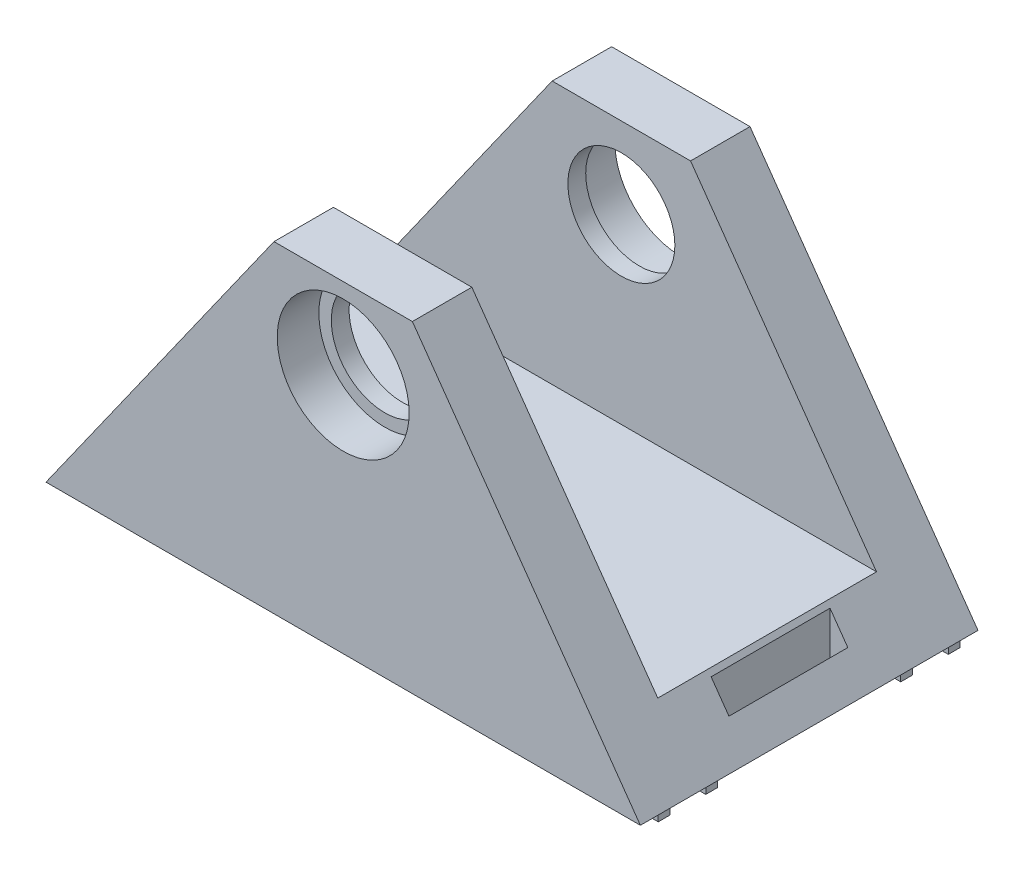
from build123d import *

# Parameters (mm, degrees)
SKETCH_1_W             = 100
SKETCH_1_H             = 28.4
EXTRUDE_1_DEPTH        = 10
SKETCH_2_W             = 100
SKETCH_2_H             = 10
EXTRUDE_2_DEPTH        = 45.6
FILLET_2_R             = 50
SKETCH_3_R             = 11.1
CUT_EXTRUDE_1_DEPTH    = 7
FILLET_2_OF_MIRROR_2_R = 50
SKETCH_8_R             = 9
CUT_EXTRUDE_2_DEPTH    = 90.840970609
SKETCH2_W              = 3
SKETCH2_H              = 20
CUT_EXTRUDE1_DEPTH     = 87.058817096
SKETCH3_OUTSIDE_W      = 127.548
SKETCH3_OUTSIDE_H      = 83.148
CUT_EXTRUDE3_DEPTH     = 94.902076654
SKETCH1_W              = 100
SKETCH1_H              = 2
SKETCH1_W_2            = 1.153846154
SKETCH1_H_2            = 18
SKETCH1_W_3            = 1.153846153
BOSS_EXTRUDE1_DEPTH    = 1
CUT_EXTRUDE4_DEPTH     = 94.902076708


with BuildPart() as part:
    # Эскиз1 → Бобышка-Вытянуть1 (new body)
    with BuildSketch(Plane(origin=(0, 0, 0), x_dir=(1, 0, 0), z_dir=(0, 1, 0))):
        Rectangle(SKETCH_1_W, SKETCH_1_H)
    extrude_1 = extrude(amount=EXTRUDE_1_DEPTH)

    # Эскиз2 → Бобышка-Вытянуть2 (add)
    with BuildSketch(Plane(origin=(0, 10, 0), x_dir=(1, 0, 0), z_dir=(0, 1, 0))):
        with Locations((0, -9.2)):
            Rectangle(SKETCH_2_W, SKETCH_2_H)
    extrude_2 = extrude(amount=EXTRUDE_2_DEPTH)

    # Скругление2
    fillet_2_edges = [part.edges().sort_by_distance(p)[0] for p in [
        (50, 55.6, 9.2),
        (-50, 55.6, 9.2),
    ]]
    fillet(fillet_2_edges, radius=FILLET_2_R - 0.0001)  # a hair under: the kernel refuses the full size

    # Эскиз3 → Вырез-Вытянуть1 (cut)
    with BuildSketch(Plane.XY.offset(14.2)):
        with Locations((0, 40.6)):
            Circle(SKETCH_3_R)
    cut_extrude_1 = extrude(amount=-CUT_EXTRUDE_1_DEPTH, mode=Mode.SUBTRACT)


with BuildPart() as mirror_2_1:
    # Зеркальное отражение2: Бобышка-Вытянуть1, Бобышка-Вытянуть2 across plane
    add(extrude_1.mirror(Plane(origin=(-50, 10, -14.2), x_dir=(1, 0, 0), z_dir=(0, 0, 1))))
    add(extrude_2.mirror(Plane(origin=(-50, 10, -14.2), x_dir=(1, 0, 0), z_dir=(0, 0, 1))))

    # Mirror 2 2: Вырез-Вытянуть1 across plane
    add(cut_extrude_1.mirror(Plane(origin=(-50, 10, -14.2), x_dir=(1, 0, 0), z_dir=(0, 0, 1))), mode=Mode.SUBTRACT)

    # Скругление2 of Зеркальное отражение2
    fillet_2_of_mirror_2_edges = [mirror_2_1.edges().sort_by_distance(p)[0] for p in [
        (50, 55.6, -37.6),
        (-50, 55.6, -37.6),
    ]]
    fillet(fillet_2_of_mirror_2_edges, radius=FILLET_2_OF_MIRROR_2_R - 0.0001)  # a hair under: the kernel refuses the full size


with BuildPart() as part_1:
    add(part.part)

    # Зеркальное отражение2 united with what the copies tou: union Зеркальное отражение2_1
    add(mirror_2_1.part)

    # Эскиз8 → Вырез-Вытянуть2 (cut, through all)
    with BuildSketch(Plane.XY.offset(7.2)):
        with Locations((0, 40.6)):
            Circle(SKETCH_8_R)
    extrude(amount=-CUT_EXTRUDE_2_DEPTH, mode=Mode.SUBTRACT)

    # Sketch2 → Cut-Extrude1 (cut, through all)
    with BuildSketch(Plane.XZ):
        with Locations((-45, -14.2)):
            Rectangle(SKETCH2_W, SKETCH2_H)
        with Locations((45, -14.2)):
            Rectangle(SKETCH2_W, SKETCH2_H)
    extrude(amount=-CUT_EXTRUDE1_DEPTH, mode=Mode.SUBTRACT)

    # Sketch3 outside → Cut-Extrude3 (cut, through all)
    with BuildSketch(Plane(origin=(0, 0, -42.6), x_dir=(-1, 0, 0), z_dir=(0, 0, -1))):
        with Locations((0, 27.8)):
            Rectangle(SKETCH3_OUTSIDE_W, SKETCH3_OUTSIDE_H)
        with BuildLine():
            Line((-50, 0), (-11.641765151, 54.225809034))
            ThreePointArc((-11.641765151, 54.225809034), (0, 55.6), (11.641765151, 54.225809034))
            Line((11.641765151, 54.225809034), (50, 0))
            Line((50, 0), (-50, 0))
        make_face(mode=Mode.SUBTRACT)
    extrude(amount=-CUT_EXTRUDE3_DEPTH, mode=Mode.SUBTRACT)

    # Sketch1 → Boss-Extrude1 (add)
    # profile 1 of 17: a face of its own
    with BuildSketch(Plane.XZ):
        with Locations((0, 10.2)):
            Rectangle(SKETCH1_W, SKETCH1_H)
    # profile 2 of 17: a face of its own
    with BuildSketch(Plane.XZ):
        with Locations((0, 2.2)):
            Rectangle(SKETCH1_W, SKETCH1_H)
    # profile 3 of 17: a face of its own
    with BuildSketch(Plane.XZ):
        with Locations((0, -30.6)):
            Rectangle(SKETCH1_W, SKETCH1_H)
    # profile 4 of 17: a face of its own
    with BuildSketch(Plane.XZ):
        with Locations((0, -38.6)):
            Rectangle(SKETCH1_W, SKETCH1_H)
    # profile 5 of 17: a face of its own
    with BuildSketch(Plane.XZ):
        with BuildLine():
            Line((-40.638461538, -16.369230769), (-39.484615385, -16.369230769))
            add(Edge.make_bspline(
                [(-39.484615385, -16.369230769), (-39.470240069, -16.596617655), (-39.44279661, -17.03071477), (-39.365105323, -17.648903711), (-39.272429521, -18.205370063), (-39.146233002, -18.700136872), (-38.990553559, -19.14241624), (-38.797560103, -19.538074087), (-38.558801391, -19.88711608), (-38.293474168, -20.194192475), (-37.993730655, -20.441175936), (-37.673503913, -20.621857637), (-37.331935649, -20.733158575), (-37.097203659, -20.746902209), (-36.978605769, -20.753846154)],
                knots=[0, 0, 0, 0, 1.476778541, 2.81927122, 4.037588394, 5.131871797, 6.125167747, 7.073045178, 7.976447362, 8.859765014, 9.69586766, 10.48072617, 11.232389795, 12, 12, 12, 12], degree=3))
            add(Edge.make_bspline(
                [(-36.978605769, -20.753846154), (-36.873337395, -20.750034724), (-36.666514199, -20.742546321), (-36.370365183, -20.651957179), (-36.089166188, -20.523109791), (-35.834497024, -20.33171486), (-35.603177794, -20.097333476), (-35.404587047, -19.818448735), (-35.232796258, -19.503626344), (-35.105040234, -19.150543102), (-35.001248797, -18.778965217), (-34.926077834, -18.395572012), (-34.876581466, -18.006345819), (-34.871683203, -17.744380463), (-34.869230769, -17.613221154)],
                knots=[0, 0, 0, 0, 0.898159175, 1.76463399, 2.630008209, 3.535623063, 4.474309597, 5.439690797, 6.45724568, 7.535187984, 8.646219107, 9.758202923, 10.877589923, 12, 12, 12, 12], degree=3))
            add(Edge.make_bspline(
                [(-34.869230769, -17.613221154), (-34.871727675, -17.483266794), (-34.876574462, -17.231010117), (-34.92155378, -16.867023087), (-34.987979097, -16.52680655), (-35.088962238, -16.211910774), (-35.223777726, -15.917601377), (-35.397418068, -15.646269438), (-35.612722275, -15.395980759), (-35.784019122, -15.255027793), (-35.871634615, -15.182932692)],
                knots=[0, 0, 0, 0, 1.141262938, 2.215325403, 3.217692236, 4.182821609, 5.113601202, 6.0539165, 7.004610607, 8, 8, 8, 8], degree=3))
            add(Edge.make_bspline(
                [(-35.871634615, -15.182932692), (-35.904856333, -15.157068563), (-35.978627549, -15.099635403), (-36.111161552, -15.019936359), (-36.263722176, -14.921033064), (-36.445510914, -14.816582227), (-36.655670934, -14.705405164), (-36.892891163, -14.583637393), (-37.15605257, -14.450074402), (-37.528608514, -14.264929513), (-37.975259739, -14.038174056), (-38.44571128, -13.752014016), (-38.833801628, -13.480550628), (-39.043081268, -13.2802365), (-39.138461538, -13.188942308)],
                knots=[0, 0, 0, 0, 0.394245612, 0.875450753, 1.447377332, 2.09846139, 2.839245878, 3.675529186, 4.597402822, 5.604899952, 7.574872462, 9.288395252, 10.764172218, 12, 12, 12, 12], degree=3))
            add(Edge.make_bspline(
                [(-39.138461538, -13.188942308), (-39.241135667, -13.072238788), (-39.447630986, -12.837527952), (-39.7080101, -12.438185142), (-39.928790257, -12.000675375), (-40.103604675, -11.521853609), (-40.240616064, -11.00884278), (-40.334600048, -10.464434586), (-40.400206131, -9.891255139), (-40.405155603, -9.49923539), (-40.407692308, -9.298317308)],
                knots=[0, 0, 0, 0, 0.889041188, 1.788014626, 2.720525071, 3.689472716, 4.701054498, 5.756667369, 6.850246473, 8, 8, 8, 8], degree=3))
            add(Edge.make_bspline(
                [(-40.407692308, -9.298317308), (-40.402701433, -9.07576653), (-40.392854974, -8.636697839), (-40.319158363, -7.99046285), (-40.200178795, -7.367171614), (-40.037149209, -6.772619837), (-39.829756508, -6.221805409), (-39.574641924, -5.731786189), (-39.269876191, -5.316366752), (-38.925024855, -4.973681021), (-38.547822053, -4.703215562), (-38.145223594, -4.510255541), (-37.719519885, -4.392632081), (-37.428859642, -4.377103832), (-37.281490385, -4.369230769)],
                knots=[0, 0, 0, 0, 1.236485598, 2.439452788, 3.60918054, 4.759663196, 5.861119231, 6.873962529, 7.819732486, 8.712337971, 9.564836949, 10.386372061, 11.181865577, 12, 12, 12, 12], degree=3))
            add(Edge.make_bspline(
                [(-37.281490385, -4.369230769), (-37.120854172, -4.376462962), (-36.805766375, -4.390648902), (-36.348019557, -4.515245023), (-35.922797189, -4.719682583), (-35.529139192, -5.002875846), (-35.168257302, -5.359349935), (-34.855459962, -5.79731981), (-34.587996233, -6.309006145), (-34.36922057, -6.889032343), (-34.191354819, -7.523978514), (-34.057398603, -8.2050002), (-33.975910157, -8.927487832), (-33.956231096, -9.423119899), (-33.946153846, -9.676923077)],
                knots=[0, 0, 0, 0, 0.829483579, 1.627031341, 2.433250974, 3.257665783, 4.123495838, 5.044753213, 6.029002171, 7.101332963, 8.244528218, 9.435456943, 10.686749258, 12, 12, 12, 12], degree=3))
            Line((-33.946153846, -9.676923077), (-35.1, -9.676923077))
            add(Edge.make_bspline(
                [(-35.1, -9.676923077), (-35.108313553, -9.548194977), (-35.124507677, -9.29744313), (-35.169645089, -8.93451771), (-35.220292019, -8.594112104), (-35.294167263, -8.280639774), (-35.376614716, -7.991671244), (-35.468873937, -7.724857805), (-35.581513568, -7.484889615), (-35.703025002, -7.266005554), (-35.84085689, -7.073686026), (-35.992856496, -6.904553964), (-36.163378237, -6.765238869), (-36.346695388, -6.64504225), (-36.548624984, -6.557807018), (-36.764473233, -6.489850217), (-36.996793923, -6.456074551), (-37.156407826, -6.449515712), (-37.238221154, -6.446153846)],
                knots=[0, 0, 0, 0, 1.42965333, 2.784848158, 4.053155636, 5.242584303, 6.351687018, 7.384193992, 8.367830726, 9.286707789, 10.155636564, 10.98558737, 11.799337186, 12.590297035, 13.407421389, 14.22931162, 15.092397929, 16, 16, 16, 16], degree=3))
            add(Edge.make_bspline(
                [(-37.238221154, -6.446153846), (-37.323782274, -6.44727498), (-37.488716914, -6.449436171), (-37.726234132, -6.493098806), (-37.946642057, -6.551063507), (-38.148824706, -6.640065235), (-38.332546739, -6.75221238), (-38.502531383, -6.886636015), (-38.649061822, -7.050761306), (-38.823592916, -7.299122737), (-38.993936421, -7.650434557), (-39.149212103, -8.107677475), (-39.238924014, -8.60732932), (-39.248781326, -8.954216372), (-39.253846154, -9.132451923)],
                knots=[0, 0, 0, 0, 0.811019, 1.563386801, 2.286085922, 2.970938193, 3.652071782, 4.325803093, 5.020568278, 5.733011965, 7.202937869, 8.707889852, 10.308466513, 12, 12, 12, 12], degree=3))
            add(Edge.make_bspline(
                [(-39.253846154, -9.132451923), (-39.25033482, -9.286638358), (-39.243606789, -9.58207341), (-39.17505776, -10.003170282), (-39.078847482, -10.38703283), (-38.965748468, -10.613544413), (-38.911298077, -10.722596154)],
                knots=[0, 0, 0, 0, 1.125042715, 2.155682834, 3.112071911, 4, 4, 4, 4], degree=3))
            add(Edge.make_bspline(
                [(-38.911298077, -10.722596154), (-38.87887715, -10.775141525), (-38.810132888, -10.886556995), (-38.674240722, -11.045379752), (-38.503319965, -11.202800868), (-38.300363896, -11.361408357), (-38.063409325, -11.520218993), (-37.793819538, -11.681417103), (-37.49056137, -11.843808094), (-37.161415843, -11.9993082), (-36.830986368, -12.156850667), (-36.517961441, -12.310965878), (-36.231499202, -12.459371164), (-35.972653066, -12.601140025), (-35.743810001, -12.743496256), (-35.542828782, -12.879282828), (-35.368221091, -13.009167934), (-35.264269213, -13.097107105), (-35.215384615, -13.138461538)],
                knots=[0, 0, 0, 0, 0.663902341, 1.407716605, 2.240709003, 3.162151828, 4.177708994, 5.309352116, 6.542302523, 7.879028444, 9.227412714, 10.483032392, 11.634617897, 12.70028532, 13.658946062, 14.534557668, 15.310858445, 16, 16, 16, 16], degree=3))
            add(Edge.make_bspline(
                [(-35.215384615, -13.138461538), (-35.091271425, -13.262487039), (-34.842607481, -13.510975294), (-34.536810296, -13.949937764), (-34.274330041, -14.42995553), (-34.07261966, -14.961964512), (-33.90892847, -15.533392773), (-33.795709078, -16.149198556), (-33.726140303, -16.806314395), (-33.719033491, -17.258472104), (-33.715384615, -17.490625)],
                knots=[0, 0, 0, 0, 0.887701028, 1.778531668, 2.699812275, 3.654560257, 4.655306023, 5.709062331, 6.823755953, 8, 8, 8, 8], degree=3))
            add(Edge.make_bspline(
                [(-33.715384615, -17.490625), (-33.720463952, -17.72516724), (-33.730464754, -18.186961833), (-33.803020723, -18.870998108), (-33.930054879, -19.532315192), (-34.100317821, -20.167507968), (-34.315034718, -20.757640722), (-34.577938696, -21.287511035), (-34.889890711, -21.745121009), (-35.23842285, -22.133350408), (-35.620567866, -22.445904957), (-36.036644302, -22.66481407), (-36.475383961, -22.807513004), (-36.779215327, -22.822996779), (-36.931730769, -22.830769231)],
                knots=[0, 0, 0, 0, 1.228451076, 2.418720254, 3.597898869, 4.752485211, 5.859990663, 6.882028285, 7.842446672, 8.751689625, 9.60709352, 10.412573381, 11.203153136, 12, 12, 12, 12], degree=3))
            add(Edge.make_bspline(
                [(-36.931730769, -22.830769231), (-37.028012027, -22.829083514), (-37.217676594, -22.82576282), (-37.495033994, -22.787923719), (-37.762050135, -22.730569605), (-38.0174662, -22.648414872), (-38.259833653, -22.539534588), (-38.488979137, -22.406982615), (-38.710076719, -22.257325659), (-38.916595329, -22.078037493), (-39.110419138, -21.875212162), (-39.296370445, -21.65168912), (-39.46481157, -21.399381019), (-39.626825875, -21.126512361), (-39.778908684, -20.829208902), (-39.918336814, -20.508401251), (-40.048790482, -20.16440629), (-40.207985741, -19.669173139), (-40.374606617, -19.008062348), (-40.514777163, -18.172238921), (-40.612241573, -17.287282165), (-40.629563053, -16.680797426), (-40.638461538, -16.369230769)],
                knots=[0, 0, 0, 0, 0.697916832, 1.374827219, 2.026335778, 2.676968848, 3.316943287, 3.949512024, 4.595161574, 5.250450397, 5.928650726, 6.628524948, 7.356346523, 8.126334024, 8.929510947, 9.776622364, 10.662287248, 11.596886092, 13.548473786, 15.600852347, 17.740045811, 20, 20, 20, 20], degree=3))
        make_face()
    # profile 6 of 17: a face of its own
    with BuildSketch(Plane.XZ):
        with Locations((-32.123076923, -13.6)):
            Rectangle(SKETCH1_W_2, SKETCH1_H_2)
    # profile 7 of 17: a face of its own
    with BuildSketch(Plane.XZ):
        with BuildLine():
            Line((-30.3, -22.6), (-30.3, -4.6))
            Line((-30.3, -4.6), (-28.396153846, -4.6))
            Line((-28.396153846, -4.6), (-26.427403846, -17.231009615))
            add(Edge.make_bspline(
                [(-26.427403846, -17.231009615), (-26.405794892, -17.374042341), (-26.364024011, -17.650529717), (-26.303121605, -18.050831215), (-26.244133517, -18.421845884), (-26.194483406, -18.765903372), (-26.147556468, -19.082001053), (-26.104826688, -19.370543063), (-26.063510407, -19.630941859), (-26.04129709, -19.79587124), (-26.030769231, -19.874038462)],
                knots=[0, 0, 0, 0, 1.298987977, 2.510990224, 3.63601153, 4.6724294, 5.632529389, 6.505636504, 7.291756016, 8, 8, 8, 8], degree=3))
            add(Edge.make_bspline(
                [(-26.030769231, -19.874038462), (-26.018944381, -19.788673647), (-25.993778376, -19.606997645), (-25.949941213, -19.321197736), (-25.903124269, -19.006285963), (-25.852334869, -18.663783022), (-25.799497527, -18.292023468), (-25.736588959, -17.892205537), (-25.673154549, -17.462709551), (-25.626024894, -17.167260982), (-25.601682692, -17.014663462)],
                knots=[0, 0, 0, 0, 0.715320173, 1.522366223, 2.399954946, 3.357955327, 4.396370647, 5.516670333, 6.717374232, 8, 8, 8, 8], degree=3))
            Line((-25.601682692, -17.014663462), (-23.665384615, -4.6))
            Line((-23.665384615, -4.6), (-21.761538462, -4.6))
            Line((-21.761538462, -4.6), (-21.761538462, -22.6))
            Line((-21.761538462, -22.6), (-22.915384615, -22.6))
            Line((-22.915384615, -22.6), (-22.915384615, -7.369230769))
            Line((-22.915384615, -7.369230769), (-25.251923077, -22.6))
            Line((-25.251923077, -22.6), (-26.809615385, -22.6))
            Line((-26.809615385, -22.6), (-29.146153846, -7.369230769))
            Line((-29.146153846, -7.369230769), (-29.146153846, -22.6))
            Line((-29.146153846, -22.6), (-30.3, -22.6))
        make_face()
    # profile 8 of 17: a face of its own
    with BuildSketch(Plane.XZ):
        with BuildLine():
            Line((-14.515384615, -16.246634615), (-13.361538462, -16.837980769))
            add(Edge.make_bspline(
                [(-13.361538462, -16.837980769), (-13.392293499, -17.075000097), (-13.451935185, -17.534639667), (-13.566911058, -18.201452035), (-13.705121838, -18.82375911), (-13.853576767, -19.404855568), (-14.024799586, -19.941142768), (-14.208372783, -20.43594912), (-14.420653792, -20.884256023), (-14.641448838, -21.292071207), (-14.878353952, -21.654338639), (-15.131888959, -21.967598698), (-15.399402727, -22.232209508), (-15.677258365, -22.451686906), (-15.970810015, -22.621782581), (-16.278840553, -22.740092039), (-16.599515067, -22.815811524), (-16.817856964, -22.825764599), (-16.927644231, -22.830769231)],
                knots=[0, 0, 0, 0, 1.5193499, 2.946398261, 4.299805446, 5.571177664, 6.757700431, 7.877387893, 8.923396472, 9.908256442, 10.823775054, 11.671065638, 12.465325907, 13.21121476, 13.916343278, 14.613058763, 15.302614435, 16, 16, 16, 16], degree=3))
            add(Edge.make_bspline(
                [(-16.927644231, -22.830769231), (-17.040820301, -22.827321191), (-17.263696051, -22.820531022), (-17.590079733, -22.766392859), (-17.899603014, -22.6710358), (-18.192072886, -22.54061082), (-18.470446108, -22.376672837), (-18.731532723, -22.17362549), (-18.971667411, -21.928960322), (-19.200893037, -21.653544859), (-19.412144273, -21.341990968), (-19.611892776, -20.997801945), (-19.79282099, -20.618645838), (-19.967331224, -20.208882805), (-20.129196383, -19.767741032), (-20.27244128, -19.291351426), (-20.405124905, -18.783626555), (-20.569932366, -18.057545156), (-20.73236129, -17.106781567), (-20.871364768, -15.929649614), (-20.961278811, -14.711969761), (-20.971651756, -13.886217277), (-20.976923077, -13.466586538)],
                knots=[0, 0, 0, 0, 0.60887351, 1.199044466, 1.77399005, 2.347332488, 2.91862805, 3.508621751, 4.12150184, 4.760024969, 5.434615555, 6.144649701, 6.899689604, 7.693808557, 8.540974356, 9.426933518, 10.369832526, 11.364679693, 13.432997972, 15.556677835, 17.741993394, 20, 20, 20, 20], degree=3))
            add(Edge.make_bspline(
                [(-20.976923077, -13.466586538), (-20.975892912, -13.238194781), (-20.973859029, -12.787274769), (-20.947158034, -12.12244645), (-20.907954155, -11.480436029), (-20.854942529, -10.860951265), (-20.782096863, -10.264747979), (-20.697055512, -9.689484251), (-20.591499451, -9.13782809), (-20.47328269, -8.60850879), (-20.3416522, -8.10512567), (-20.192790435, -7.633013116), (-20.035948189, -7.189710073), (-19.858659281, -6.780287165), (-19.671553844, -6.400840278), (-19.473502645, -6.050752921), (-19.257065756, -5.735005278), (-19.030494475, -5.448183125), (-18.791919013, -5.197169613), (-18.55132227, -4.974109317), (-18.300293205, -4.789106821), (-18.043238181, -4.636385538), (-17.780129146, -4.515973806), (-17.509712434, -4.432862166), (-17.234957791, -4.380406225), (-17.049266142, -4.372954047), (-16.956490385, -4.369230769)],
                knots=[0, 0, 0, 0, 1.521152845, 3.003253126, 4.430972634, 5.805191119, 7.143735297, 8.431048613, 9.677717339, 10.883833092, 12.04310164, 13.142002956, 14.180267897, 15.173642948, 16.111668452, 16.997403118, 17.850067855, 18.658992496, 19.429198441, 20.154580437, 20.841479779, 21.501883115, 22.143233042, 22.763604345, 23.382268698, 24, 24, 24, 24], degree=3))
            add(Edge.make_bspline(
                [(-16.956490385, -4.369230769), (-16.851583823, -4.373250456), (-16.644510173, -4.381184861), (-16.340588825, -4.448884238), (-16.050739223, -4.559299986), (-15.769405821, -4.705514745), (-15.509965244, -4.90637277), (-15.257556691, -5.142209874), (-15.021985788, -5.424837361), (-14.797831281, -5.747115272), (-14.591363361, -6.108131913), (-14.394058733, -6.502838919), (-14.220648502, -6.93439654), (-14.060845762, -7.400214642), (-13.917368316, -7.899602095), (-13.792630885, -8.435567366), (-13.679111173, -9.005216309), (-13.621761237, -9.39897629), (-13.592307692, -9.601201923)],
                knots=[0, 0, 0, 0, 0.74607332, 1.472664073, 2.203623599, 2.949942136, 3.719913209, 4.530902478, 5.405044804, 6.333001834, 7.322010583, 8.362694247, 9.471612332, 10.629575204, 11.867012269, 13.168111225, 14.545610195, 16, 16, 16, 16], degree=3))
            Line((-13.592307692, -9.601201923), (-14.746153846, -10.145673077))
            add(Edge.make_bspline(
                [(-14.746153846, -10.145673077), (-14.771768261, -9.990480706), (-14.821528034, -9.688996665), (-14.907178946, -9.254678889), (-15.001256815, -8.85307655), (-15.100513193, -8.484057934), (-15.212702363, -8.14869804), (-15.331187163, -7.845108514), (-15.456205344, -7.572665469), (-15.59305384, -7.333933348), (-15.739404973, -7.126429977), (-15.889526229, -6.943507196), (-16.054036671, -6.790769291), (-16.226491947, -6.663716427), (-16.408397799, -6.565016829), (-16.598900441, -6.494966695), (-16.799779746, -6.455025502), (-16.937086529, -6.449146211), (-17.006971154, -6.446153846)],
                knots=[0, 0, 0, 0, 1.606280933, 3.120437325, 4.519791905, 5.818113984, 7.021397336, 8.129172842, 9.145074104, 10.079877348, 10.934613958, 11.736134785, 12.491694017, 13.220869476, 13.918363091, 14.597913148, 15.286384024, 16, 16, 16, 16], degree=3))
            add(Edge.make_bspline(
                [(-17.006971154, -6.446153846), (-17.086557407, -6.448551774), (-17.244749988, -6.453318105), (-17.476011347, -6.503006503), (-17.699017726, -6.577693668), (-17.908781014, -6.688426917), (-18.109961635, -6.826073851), (-18.296745182, -6.998988878), (-18.479008009, -7.197415598), (-18.706438869, -7.512886728), (-18.964435855, -7.967552035), (-19.213321756, -8.589769855), (-19.417588027, -9.292898765), (-19.570276313, -10.067071051), (-19.680243108, -10.887798173), (-19.765161082, -11.731937718), (-19.810755309, -12.589880155), (-19.818954343, -13.166059035), (-19.823076923, -13.455769231)],
                knots=[0, 0, 0, 0, 0.464748692, 0.923775043, 1.377224762, 1.836197296, 2.306073311, 2.798738052, 3.321187459, 3.879298539, 5.069318024, 6.368040087, 7.789256127, 9.345533132, 10.977717257, 12.630370562, 14.305706716, 16, 16, 16, 16], degree=3))
            add(Edge.make_bspline(
                [(-19.823076923, -13.455769231), (-19.818488631, -13.820015736), (-19.809608902, -14.524942572), (-19.753892768, -15.547908583), (-19.653065183, -16.499678102), (-19.53720128, -17.246160701), (-19.419952056, -17.801362457), (-19.322876815, -18.18400964), (-19.215630291, -18.540507488), (-19.09735343, -18.869543165), (-18.965962122, -19.171179885), (-18.827427057, -19.448228866), (-18.676209329, -19.698494204), (-18.464414213, -19.984520006), (-18.185234646, -20.283830807), (-17.819881342, -20.549341543), (-17.437848106, -20.726194949), (-17.170982777, -20.744715743), (-17.039423077, -20.753846154)],
                knots=[0, 0, 0, 0, 2.071245632, 4.008484946, 5.822900642, 7.511674809, 8.301194808, 9.048779153, 9.755773641, 10.417340349, 11.035660198, 11.62556507, 12.177635014, 12.695702883, 13.648049211, 14.490213737, 15.255703133, 16, 16, 16, 16], degree=3))
            add(Edge.make_bspline(
                [(-17.039423077, -20.753846154), (-16.960956498, -20.750487184), (-16.804542012, -20.743791448), (-16.576443797, -20.686455562), (-16.355109827, -20.599884984), (-16.147010909, -20.472341593), (-15.949362745, -20.308739736), (-15.757919856, -20.114328462), (-15.577893812, -19.881222377), (-15.40845322, -19.612880347), (-15.25134, -19.309323785), (-15.103139738, -18.97380317), (-14.969948271, -18.603841055), (-14.851300567, -18.199159453), (-14.748930277, -17.75918623), (-14.654127684, -17.285736047), (-14.575290722, -16.777989876), (-14.535729035, -16.427085574), (-14.515384615, -16.246634615)],
                knots=[0, 0, 0, 0, 0.672524471, 1.3406035, 2.007247342, 2.706079136, 3.424657311, 4.205208468, 5.043034693, 5.947382651, 6.925614449, 7.974103229, 9.093430792, 10.297937836, 11.591564485, 12.969327533, 14.441490314, 16, 16, 16, 16], degree=3))
        make_face()
    # profile 9 of 17: a face of its own
    with BuildSketch(Plane.XZ):
        Polygon((-12.576923077, -22.6), (-12.576923077, -4.6), (-11.423076923, -4.6), (-11.423076923, -11.984615385), (-6.576923077, -11.984615385), (-6.576923077, -4.6), (-5.423076923, -4.6), (-5.423076923, -22.6), (-6.576923077, -22.6), (-6.576923077, -14.061538462), (-11.423076923, -14.061538462), (-11.423076923, -22.6), align=None)
    # profile 10 of 17: a face of its own
    with BuildSketch(Plane.XZ):
        Polygon((-5.402884615, -22.6), (-1.905288462, -4.6), (-0.679326923, -4.6), (2.818269231, -22.6), (1.592307692, -22.6), (0.589903846, -17.061538462), (-3.170913462, -17.061538462), (-4.176923077, -22.6), align=None)
        with BuildLine():
            Line((-2.795913462, -14.984615385), (0.211298077, -14.984615385))
            Line((0.211298077, -14.984615385), (-0.632451923, -10.325961538))
            add(Edge.make_bspline(
                [(-0.632451923, -10.325961538), (-0.666360504, -10.142113374), (-0.73238384, -9.784142945), (-0.824537451, -9.260800713), (-0.917246319, -8.765082944), (-0.997445977, -8.295629533), (-1.078576166, -7.852441881), (-1.152892182, -7.436320035), (-1.226235716, -7.047341029), (-1.270862645, -6.797150002), (-1.292307692, -6.676923077)],
                knots=[0, 0, 0, 0, 1.209945762, 2.355883214, 3.439198162, 4.473827899, 5.438166865, 6.355192696, 7.209603446, 8, 8, 8, 8], degree=3))
            add(Edge.make_bspline(
                [(-1.292307692, -6.676923077), (-1.39180495, -7.231057109), (-1.592129241, -8.34673115), (-1.795644044, -9.461827618), (-1.898076923, -10.023076923)],
                knots=[0, 0, 0, 0, 0.993361883, 2, 2, 2, 2], degree=3))
            Line((-1.898076923, -10.023076923), (-2.795913462, -14.984615385))
        make_face(mode=Mode.SUBTRACT)
    # profile 11 of 17: a face of its own
    with BuildSketch(Plane.XZ):
        with Locations((3.876923077, -13.6)):
            Rectangle(SKETCH1_W_2, SKETCH1_H_2)
    # profile 12 of 17: a face of its own
    with BuildSketch(Plane.XZ):
        with BuildLine():
            Line((5.7, -22.6), (5.7, -4.6))
            Line((5.7, -4.6), (9.651923077, -4.6))
            add(Edge.make_bspline(
                [(9.651923077, -4.6), (9.841049283, -4.604407871), (10.196533714, -4.612692971), (10.695182452, -4.702877425), (11.123026985, -4.850865646), (11.488316142, -5.068839078), (11.798058585, -5.367714789), (12.063101682, -5.754749292), (12.297207509, -6.23002785), (12.489885653, -6.786383788), (12.65712334, -7.400065738), (12.76721174, -8.057315453), (12.844327355, -8.744799557), (12.850629923, -9.213953722), (12.853846154, -9.453365385)],
                knots=[0, 0, 0, 0, 1.025763473, 1.928040284, 2.739171094, 3.471025709, 4.218707593, 5.056892097, 6.005273118, 7.086780864, 8.24853473, 9.454312108, 10.70092303, 12, 12, 12, 12], degree=3))
            add(Edge.make_bspline(
                [(12.853846154, -9.453365385), (12.846517866, -9.756624683), (12.832414283, -10.340259308), (12.717126225, -11.179716486), (12.523830094, -11.94476979), (12.297736615, -12.529219871), (12.07516319, -12.950056864), (11.887558741, -13.231155847), (11.680932381, -13.485030761), (11.447426173, -13.703485821), (11.199471906, -13.901406344), (10.926438232, -14.064317183), (10.63132149, -14.194869027), (10.424274195, -14.259462056), (10.318990385, -14.292307692)],
                knots=[0, 0, 0, 0, 1.854560178, 3.569175099, 5.170522799, 6.672368118, 7.389440429, 8.078682941, 8.7367093, 9.386759788, 10.030962876, 10.674032136, 11.325743673, 12, 12, 12, 12], degree=3))
            add(Edge.make_bspline(
                [(10.318990385, -14.292307692), (10.45156086, -14.442909393), (10.702778812, -14.728296096), (10.885389565, -15.061582759), (10.971634615, -15.218990385)],
                knots=[0, 0, 0, 0, 1.055421991, 2, 2, 2, 2], degree=3))
            add(Edge.make_bspline(
                [(10.971634615, -15.218990385), (11.052586419, -15.392563175), (11.221291308, -15.75429172), (11.451362573, -16.332734959), (11.689148114, -16.961138372), (11.833962953, -17.402265928), (11.909134615, -17.63125)],
                knots=[0, 0, 0, 0, 0.887238616, 1.849019846, 2.883451764, 4, 4, 4, 4], degree=3))
            Line((11.909134615, -17.63125), (13.456009615, -22.6))
            Line((13.456009615, -22.6), (12.093028846, -22.6))
            Line((12.093028846, -22.6), (10.903125, -18.799519231))
            add(Edge.make_bspline(
                [(10.903125, -18.799519231), (10.821009095, -18.540839862), (10.667132164, -18.056100795), (10.439066465, -17.379632492), (10.234506215, -16.800298579), (10.052389138, -16.310826119), (9.890946734, -15.901243081), (9.737265918, -15.564613886), (9.59050678, -15.295233427), (9.414674672, -15.035366245), (9.200156489, -14.788434508), (8.992917918, -14.663184122), (8.898317308, -14.606009615)],
                knots=[0, 0, 0, 0, 1.719883433, 3.222888216, 4.523781755, 5.613173048, 6.532538996, 7.312956185, 7.957331732, 8.472805158, 9.302863535, 10, 10, 10, 10], degree=3))
            add(Edge.make_bspline(
                [(8.898317308, -14.606009615), (8.860142246, -14.592822107), (8.773483514, -14.562886001), (8.622254704, -14.543169582), (8.439766541, -14.522021638), (8.307074243, -14.522705), (8.234855769, -14.523076923)],
                knots=[0, 0, 0, 0, 0.719586631, 1.633486958, 2.712012965, 4, 4, 4, 4], degree=3))
            Line((8.234855769, -14.523076923), (6.853846154, -14.523076923))
            Line((6.853846154, -14.523076923), (6.853846154, -22.6))
            Line((6.853846154, -22.6), (5.7, -22.6))
        make_face()
        with BuildLine():
            Line((6.853846154, -12.446153846), (9.410336538, -12.446153846))
            add(Edge.make_bspline(
                [(9.410336538, -12.446153846), (9.540404359, -12.442175518), (9.787706021, -12.43461141), (10.137443843, -12.373629493), (10.445570609, -12.272912915), (10.716800762, -12.131195747), (10.949534258, -11.937106835), (11.149564573, -11.694395286), (11.318388757, -11.402376183), (11.455486734, -11.067769437), (11.566116604, -10.702981785), (11.644095483, -10.317801249), (11.693028128, -9.917374701), (11.697646702, -9.645817983), (11.7, -9.507451923)],
                knots=[0, 0, 0, 0, 1.100109627, 2.091669847, 2.99220582, 3.833965889, 4.664779489, 5.538556546, 6.482224893, 7.507885111, 8.592130926, 9.703140637, 10.829683233, 12, 12, 12, 12], degree=3))
            add(Edge.make_bspline(
                [(11.7, -9.507451923), (11.695205034, -9.309977355), (11.685998018, -8.930798099), (11.59581308, -8.389606199), (11.444796805, -7.903245833), (11.266666237, -7.540039505), (11.092697362, -7.286639765), (10.947558066, -7.120044633), (10.780272112, -6.98398306), (10.597921317, -6.869892667), (10.397323095, -6.782666681), (10.179706938, -6.723704414), (9.945696338, -6.680236668), (9.783154642, -6.678055216), (9.698798077, -6.676923077)],
                knots=[0, 0, 0, 0, 1.814305813, 3.483725208, 5.024871414, 6.482636559, 7.181481047, 7.846761179, 8.50604975, 9.156106613, 9.819180781, 10.508260582, 11.225810879, 12, 12, 12, 12], degree=3))
            Line((9.698798077, -6.676923077), (6.853846154, -6.676923077))
            Line((6.853846154, -6.676923077), (6.853846154, -12.446153846))
        make_face(mode=Mode.SUBTRACT)
    # profile 13 of 17: a face of its own
    with BuildSketch(Plane.XZ):
        with BuildLine():
            Line((16.5, -22.6), (16.5, -4.6))
            Line((16.5, -4.6), (18.403846154, -4.6))
            Line((18.403846154, -4.6), (20.372596154, -17.231009615))
            add(Edge.make_bspline(
                [(20.372596154, -17.231009615), (20.394205108, -17.374042341), (20.435975989, -17.650529717), (20.496878395, -18.050831215), (20.555866483, -18.421845884), (20.605516594, -18.765903372), (20.652443532, -19.082001053), (20.695173312, -19.370543063), (20.736489593, -19.630941859), (20.75870291, -19.79587124), (20.769230769, -19.874038462)],
                knots=[0, 0, 0, 0, 1.298987977, 2.510990224, 3.63601153, 4.6724294, 5.632529389, 6.505636504, 7.291756016, 8, 8, 8, 8], degree=3))
            add(Edge.make_bspline(
                [(20.769230769, -19.874038462), (20.781055619, -19.788673647), (20.806221624, -19.606997645), (20.850058787, -19.321197736), (20.896875731, -19.006285963), (20.947665131, -18.663783022), (21.000502473, -18.292023468), (21.063411041, -17.892205537), (21.126845451, -17.462709551), (21.173975106, -17.167260982), (21.198317308, -17.014663462)],
                knots=[0, 0, 0, 0, 0.715320173, 1.522366223, 2.399954946, 3.357955327, 4.396370647, 5.516670333, 6.717374232, 8, 8, 8, 8], degree=3))
            Line((21.198317308, -17.014663462), (23.134615385, -4.6))
            Line((23.134615385, -4.6), (25.038461538, -4.6))
            Line((25.038461538, -4.6), (25.038461538, -22.6))
            Line((25.038461538, -22.6), (23.884615385, -22.6))
            Line((23.884615385, -22.6), (23.884615385, -7.369230769))
            Line((23.884615385, -7.369230769), (21.548076923, -22.6))
            Line((21.548076923, -22.6), (19.990384615, -22.6))
            Line((19.990384615, -22.6), (17.653846154, -7.369230769))
            Line((17.653846154, -7.369230769), (17.653846154, -22.6))
            Line((17.653846154, -22.6), (16.5, -22.6))
        make_face()
    # profile 14 of 17: a face of its own
    with BuildSketch(Plane.XZ):
        Polygon((26.053846154, -22.6), (26.053846154, -4.6), (27.207692308, -4.6), (27.207692308, -13.138461538), (31.559855769, -4.6), (33.207692308, -4.6), (29.482932692, -11.908894231), (33.438461538, -22.6), (32.003365385, -22.6), (28.65, -13.542307692), (27.207692308, -16.369230769), (27.207692308, -22.6), align=None)
    # profile 15 of 17: a face of its own
    with BuildSketch(Plane.XZ):
        with Locations((34.338461538, -13.6)):
            Rectangle(SKETCH1_W_3, SKETCH1_H_2)
    # profile 16 of 17: a face of its own
    with BuildSketch(Plane.XZ):
        with Locations((36.969230769, -13.6)):
            Rectangle(SKETCH1_W_2, SKETCH1_H_2)
    # profile 17 of 17: a face of its own
    with BuildSketch(Plane.XZ):
        with Locations((39.6, -13.6)):
            Rectangle(SKETCH1_W_2, SKETCH1_H_2)
    extrude(amount=BOSS_EXTRUDE1_DEPTH)

    # Sketch4 → Cut-Extrude4 (cut, through all)
    with BuildSketch(Plane.XY.offset(14.2)):
        with BuildLine():
            Line((11.641765151, 54.225809034), (-11.641765151, 54.225809034))
            ThreePointArc((-11.641765151, 54.225809034), (0, 55.6), (11.641765151, 54.225809034))
        make_face()
    extrude(amount=-CUT_EXTRUDE4_DEPTH, mode=Mode.SUBTRACT)


solid = part_1.part
